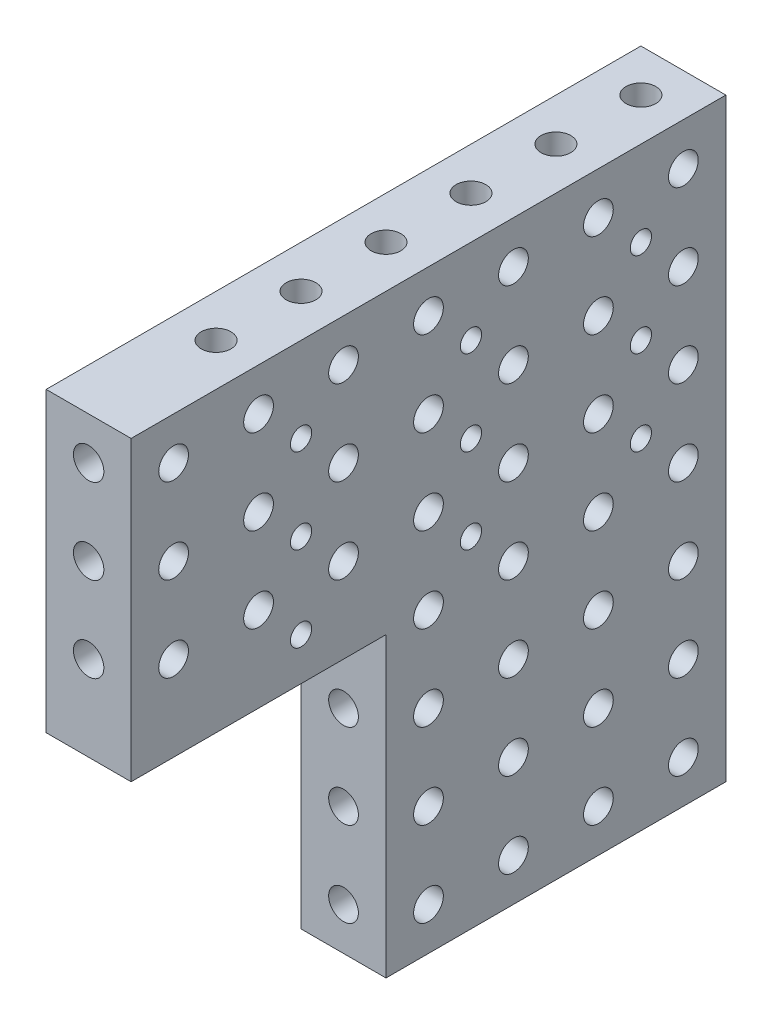
from build123d import *

# Parameters (mm, degrees)
ESQUISSE1_W                 = 10
ESQUISSE1_H                 = 70
ESQUISSE1_R                 = 1.75
BOSS_EXTRU_1_DEPTH          = 35
ESQUISSE2_W                 = 10
ESQUISSE2_H                 = 70
BOSS_EXTRU_2_DEPTH          = 5
ESQUISSE3_W                 = 10
ESQUISSE3_H                 = 35
BOSS_EXTRU_3_DEPTH          = 30
ESQUISSE4_R                 = 1.75
ENL_V_MAT_EXTRU_1_DEPTH     = 100.498743711
ESQUISSE5_R                 = 1.75
ESQUISSE5_R_2               = 1.25
ENL_V_MAT_EXTRU_2_DEPTH     = 100.498743711
ENL_V_START                 = 46.208496063
ENL_V_MAT_EXTRU_3_OUTLINE_R = 1.79
ENL_V_MAT_EXTRU_3_DEPTH     = 23.791503937
ESQUISSE7_R                 = 1.75
ENL_V_MAT_EXTRU_4_DEPTH     = 82.240384145


# Read off the part's stored shape, not the designer's step: Enlèv. mat.-Extru.3
with BuildPart() as part:
    # Esquisse1 → Boss.-Extru.1 (new body)
    with BuildSketch(Plane.XY):
        with Locations((5, 35)):
            Rectangle(ESQUISSE1_W, ESQUISSE1_H)
        with Locations((5, 35)):
            Circle(ESQUISSE1_R, mode=Mode.SUBTRACT)
        with Locations((5, 45)):
            Circle(ESQUISSE1_R, mode=Mode.SUBTRACT)
        with Locations((5, 55)):
            Circle(ESQUISSE1_R, mode=Mode.SUBTRACT)
        with Locations((5, 65)):
            Circle(ESQUISSE1_R, mode=Mode.SUBTRACT)
        with Locations((5, 25)):
            Circle(ESQUISSE1_R, mode=Mode.SUBTRACT)
        with Locations((5, 15)):
            Circle(ESQUISSE1_R, mode=Mode.SUBTRACT)
        with Locations((5, 5)):
            Circle(ESQUISSE1_R, mode=Mode.SUBTRACT)
    extrude(amount=BOSS_EXTRU_1_DEPTH)

    # Esquisse2 → Boss.-Extru.2 (add)
    with BuildSketch(Plane.XY.offset(35)):
        with Locations((5, 35)):
            Rectangle(ESQUISSE2_W, ESQUISSE2_H)
    extrude(amount=BOSS_EXTRU_2_DEPTH)

    # Esquisse3 → Boss.-Extru.3 (add)
    with BuildSketch(Plane.XY.offset(40)):
        with Locations((5, 52.5)):
            Rectangle(ESQUISSE3_W, ESQUISSE3_H)
    extrude(amount=BOSS_EXTRU_3_DEPTH)

    # Esquisse4 → Enlèv. mat.-Extru.1 (cut, through all)
    with BuildSketch(Plane(origin=(0, 0, 0), x_dir=(-1, 0, 0), z_dir=(0, -1, 0))):
        with Locations(Location((-5, -55, 0), (0, 0, 90))):
            Circle(ESQUISSE4_R)
        with Locations(Location((-5, -45, 0), (0, 0, 90))):
            Circle(ESQUISSE4_R)
        with Locations(Location((-5, -35, 0), (0, 0, 90))):
            Circle(ESQUISSE4_R)
        with Locations(Location((-5, -25, 0), (0, 0, 90))):
            Circle(ESQUISSE4_R)
        with Locations(Location((-5, -15, 0), (0, 0, 90))):
            Circle(ESQUISSE4_R)
        with Locations(Location((-5, -5, 0), (0, 0, 180))):
            Circle(ESQUISSE4_R)
    extrude(amount=-ENL_V_MAT_EXTRU_1_DEPTH, mode=Mode.SUBTRACT)

    # Esquisse5 → Enlèv. mat.-Extru.2 (cut, through all)
    with BuildSketch(Plane(origin=(10, 0, 0), x_dir=(0, 0, -1), z_dir=(1, 0, 0))):
        with Locations(Location((-5, 65, 0), (0, 0, 90))):
            Circle(ESQUISSE5_R)
        with Locations(Location((-15, 65, 0), (0, 0, 90))):
            Circle(ESQUISSE5_R)
        with Locations(Location((-25, 65, 0), (0, 0, 90))):
            Circle(ESQUISSE5_R)
        with Locations(Location((-35, 65, 0), (0, 0, 90))):
            Circle(ESQUISSE5_R)
        with Locations(Location((-45, 65, 0), (0, 0, 90))):
            Circle(ESQUISSE5_R)
        with Locations(Location((-55, 65, 0), (0, 0, 90))):
            Circle(ESQUISSE5_R)
        with Locations(Location((-5, 55, 0), (0, 0, 90))):
            Circle(ESQUISSE5_R)
        with Locations(Location((-15, 55, 0), (0, 0, 90))):
            Circle(ESQUISSE5_R)
        with Locations(Location((-25, 55, 0), (0, 0, 90))):
            Circle(ESQUISSE5_R)
        with Locations(Location((-35, 55, 0), (0, 0, 90))):
            Circle(ESQUISSE5_R)
        with Locations(Location((-45, 55, 0), (0, 0, 90))):
            Circle(ESQUISSE5_R)
        with Locations(Location((-55, 55, 0), (0, 0, 90))):
            Circle(ESQUISSE5_R)
        with Locations(Location((-5, 45, 0), (0, 0, 90))):
            Circle(ESQUISSE5_R)
        with Locations(Location((-15, 45, 0), (0, 0, 90))):
            Circle(ESQUISSE5_R)
        with Locations(Location((-25, 45, 0), (0, 0, 90))):
            Circle(ESQUISSE5_R)
        with Locations(Location((-35, 45, 0), (0, 0, 90))):
            Circle(ESQUISSE5_R)
        with Locations(Location((-45, 45, 0), (0, 0, 90))):
            Circle(ESQUISSE5_R)
        with Locations(Location((-55, 45, 0), (0, 0, 90))):
            Circle(ESQUISSE5_R)
        with Locations(Location((-5, 35, 0), (0, 0, 90))):
            Circle(ESQUISSE5_R)
        with Locations(Location((-15, 35, 0), (0, 0, 90))):
            Circle(ESQUISSE5_R)
        with Locations(Location((-25, 35, 0), (0, 0, 90))):
            Circle(ESQUISSE5_R)
        with Locations(Location((-35, 35, 0), (0, 0, 90))):
            Circle(ESQUISSE5_R)
        with Locations(Location((-5, 25, 0), (0, 0, 90))):
            Circle(ESQUISSE5_R)
        with Locations(Location((-15, 25, 0), (0, 0, 90))):
            Circle(ESQUISSE5_R)
        with Locations(Location((-25, 25, 0), (0, 0, 90))):
            Circle(ESQUISSE5_R)
        with Locations(Location((-35, 25, 0), (0, 0, 90))):
            Circle(ESQUISSE5_R)
        with Locations(Location((-5, 15, 0), (0, 0, 90))):
            Circle(ESQUISSE5_R)
        with Locations(Location((-15, 15, 0), (0, 0, 90))):
            Circle(ESQUISSE5_R)
        with Locations(Location((-25, 15, 0), (0, 0, 90))):
            Circle(ESQUISSE5_R)
        with Locations(Location((-35, 15, 0), (0, 0, 90))):
            Circle(ESQUISSE5_R)
        with Locations(Location((-5, 5, 0), (0, 0, 90))):
            Circle(ESQUISSE5_R)
        with Locations(Location((-15, 5, 0), (0, 0, 90))):
            Circle(ESQUISSE5_R)
        with Locations(Location((-25, 5, 0), (0, 0, 90))):
            Circle(ESQUISSE5_R)
        with Locations(Location((-35, 5, 0), (0, 0, 90))):
            Circle(ESQUISSE5_R)
        with Locations(Location((-10, 60, 0), (0, 0, 90))):
            Circle(ESQUISSE5_R_2)
        with Locations(Location((-30, 60, 0), (0, 0, 90))):
            Circle(ESQUISSE5_R_2)
        with Locations(Location((-50, 60, 0), (0, 0, 90))):
            Circle(ESQUISSE5_R_2)
        with Locations(Location((-50, 50, 0), (0, 0, 90))):
            Circle(ESQUISSE5_R_2)
        with Locations(Location((-30, 50, 0), (0, 0, 90))):
            Circle(ESQUISSE5_R_2)
        with Locations(Location((-10, 50, 0), (0, 0, 90))):
            Circle(ESQUISSE5_R_2)
        with Locations(Location((-50, 40, 0), (0, 0, 90))):
            Circle(ESQUISSE5_R_2)
        with Locations(Location((-30, 40, 0), (0, 0, 90))):
            Circle(ESQUISSE5_R_2)
        with Locations(Location((-10, 40, 0), (0, 0, 90))):
            Circle(ESQUISSE5_R_2)
        with Locations(Location((-65, 65, 0), (0, 0, 90))):
            Circle(ESQUISSE5_R)
        with Locations(Location((-65, 55, 0), (0, 0, 90))):
            Circle(ESQUISSE5_R)
        with Locations(Location((-65, 45, 0), (0, 0, 90))):
            Circle(ESQUISSE5_R)
    extrude(amount=-ENL_V_MAT_EXTRU_2_DEPTH, mode=Mode.SUBTRACT)

    # Enlèv. mat.-Extru.3 outline → Enlèv. mat.-Extru.3 (cut)
    with BuildSketch(Plane.XY.offset(ENL_V_START)):
        with Locations((5, 65)):
            Circle(ENL_V_MAT_EXTRU_3_OUTLINE_R)
        with Locations((5, 45)):
            Circle(ENL_V_MAT_EXTRU_3_OUTLINE_R)
        with Locations((5, 55)):
            Circle(ENL_V_MAT_EXTRU_3_OUTLINE_R)
    extrude(amount=ENL_V_MAT_EXTRU_3_DEPTH, mode=Mode.SUBTRACT)

    # Esquisse7 → Enlèv. mat.-Extru.4 (cut, through all)
    with BuildSketch(Plane.XY.offset(40)):
        with Locations(Location((5, 25, 0), (0, 0, 225))):
            Circle(ESQUISSE7_R)
        with Locations(Location((5, 15, 0), (0, 0, 225))):
            Circle(ESQUISSE7_R)
        with Locations(Location((5, 5, 0), (0, 0, 225))):
            Circle(ESQUISSE7_R)
    extrude(amount=-ENL_V_MAT_EXTRU_4_DEPTH, mode=Mode.SUBTRACT)


solid = part.part
